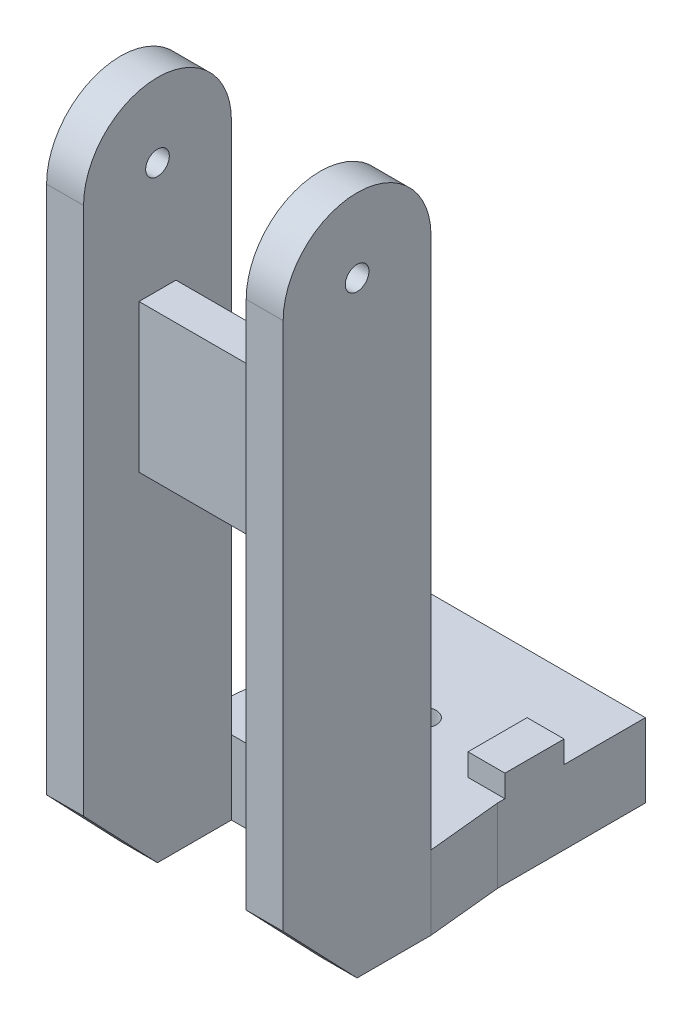
from build123d import *

# Parameters (mm, degrees)
EXTRUDE_1_DEPTH     = 10
SKETCH_4_W          = 5
SKETCH_4_H          = 8
EXTRUDE_3_DEPTH     = 3
EXTRUDE_4_DEPTH     = 16
CUT_EXTRUDE_1_DEPTH = 11
SKETCH_15_W         = 5
SKETCH_15_H         = 20
EXTRUDE_5_DEPTH     = 22
OTHER_START         = -1
OTHER_4_OUTLINE_R   = 1.6
OTHER_4_DEPTH       = 32


# Read off the part's stored shape, not the designer's step: 高级异型孔3, 高级异型孔4
with BuildPart() as part:
    # 草图1 → 凸台-拉伸1 (new body)
    with BuildSketch(Plane(origin=(0, 0, 0), x_dir=(1, 0, 0), z_dir=(0, 1, 0))):
        Polygon((0, 10), (0, 30), (30, 30), (30, 10), (31, 0), (30, 0), (0, 0), (-1, 0), align=None)
    extrude(amount=-EXTRUDE_1_DEPTH)

    # 草图4 → 凸台-拉伸3 (add)
    with BuildSketch(Plane(origin=(0, 0, 0), x_dir=(1, 0, 0), z_dir=(0, 1, 0))):
        with Locations((2.5, 15)):
            Rectangle(SKETCH_4_W, SKETCH_4_H)
        with Locations((27.5, 15)):
            Rectangle(SKETCH_4_W, SKETCH_4_H)
    extrude(amount=EXTRUDE_3_DEPTH)

    # 高级异型孔3 outline → 高级异型孔3 (revolve, cut)
    with BuildSketch(Plane(origin=(15, 0, -15), x_dir=(1, 0, 0), z_dir=(0, 0, 1))):
        Polygon((0, -10), (3.15, -10), (1.7, -8.55), (1.7, 0), (0, 0), align=None)
    revolve(axis=Axis((15, 0, -15), (0, 1, 0)), mode=Mode.SUBTRACT)

    # 草图13 → 凸台-拉伸4 (add, symmetric)
    with BuildSketch(Plane(origin=(15, 0, 0), x_dir=(0, 0, -1), z_dir=(1, 0, 0))):
        with BuildLine():
            Line((0, -10), (0, 15))
            Line((0, 15), (0, 72))
            ThreePointArc((0, 72), (-10, 82), (-20, 72))
            Line((-20, 72), (-20, 10.908419296))
            Line((-20, 10.908419296), (-20, 0.454209648))
            Line((-20, 0.454209648), (-10, -10))
            Line((-10, -10), (0, -10))
        make_face()
    extrude(amount=EXTRUDE_4_DEPTH, both=True)

    # 草图13<2> → 切除-拉伸1 (cut, symmetric)
    with BuildSketch(Plane(origin=(15, 0, 0), x_dir=(0, 0, -1), z_dir=(1, 0, 0))):
        with BuildLine():
            Line((0, -10), (0, 15))
            Line((0, 15), (0, 72))
            ThreePointArc((0, 72), (-10, 82), (-20, 72))
            Line((-20, 72), (-20, 10.908419296))
            Line((-20, 10.908419296), (-20, 0.454209648))
            Line((-20, 0.454209648), (-10, -10))
            Line((-10, -10), (0, -10))
        make_face()
    extrude(amount=CUT_EXTRUDE_1_DEPTH, both=True, mode=Mode.SUBTRACT)

    # 草图15 → 凸台-拉伸5 (add)
    with BuildSketch(Plane(origin=(4, 0, 0), x_dir=(0, 0, -1), z_dir=(1, 0, 0))):
        with Locations((-10, 47)):
            Rectangle(SKETCH_15_W, SKETCH_15_H)
    extrude(amount=EXTRUDE_5_DEPTH)

    # 高级异型孔4 outline → 高级异型孔4 (cut)
    with BuildSketch(Plane.YZ.offset(OTHER_START)):
        with Locations((72, 10)):
            Circle(OTHER_4_OUTLINE_R)
    extrude(amount=OTHER_4_DEPTH, mode=Mode.SUBTRACT)


solid = part.part
